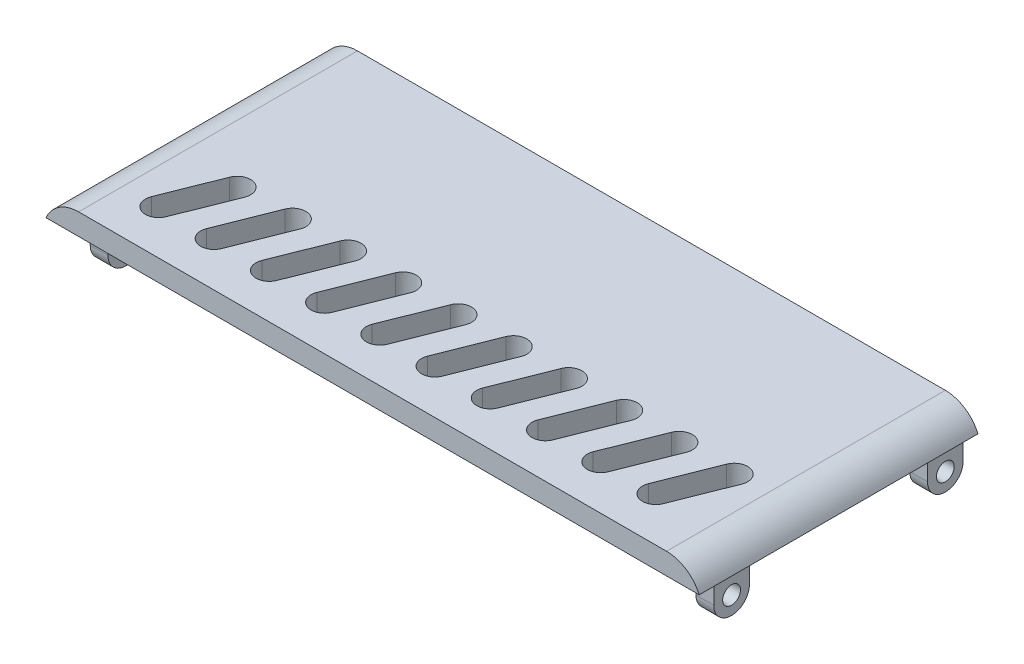
from build123d import *

# Parameters (mm, degrees)
SKETCH_2_W                     = 74
SKETCH_2_H                     = 31.3
EXTRUDE_1_DEPTH                = 4
FILLET_1_R                     = 4
SKETCH_3_W                     = 74
SKETCH_3_H                     = 1.6
CUT_EXTRUDE_1_DEPTH            = 54.265384914
CUT_EXTRUDE_6_REACH            = 49.036
SKETCH_22_W                    = 2
SKETCH_22_H                    = 4
EXTRUDE_9_DEPTH                = 5.5
FILLET_3_R                     = 2
SKETCH_23_R                    = 1
CUT_EXTRUDE_9_DEPTH            = 2
CUT_EXTRUDE_9_DRAFT            = -4
CUT_EXTRUDE_9_PROFILE_2_DEPTH  = 2
CUT_EXTRUDE_9_PROFILE_2_DRAFT  = -4
SKETCH_24_W                    = 4
SKETCH_24_H                    = 2
EXTRUDE_10_DEPTH               = 0.2
SKETCH_25_W                    = 0.670438174
SKETCH_25_H                    = 3.5
CUT_EXTRUDE_10_DEPTH           = 0.4
SKETCH_26_R                    = 1
CUT_EXTRUDE_11_DEPTH           = 2
CUT_EXTRUDE_11_DRAFT           = -4
CUT_EXTRUDE_11_PROFILE_2_DEPTH = 2
CUT_EXTRUDE_11_PROFILE_2_DRAFT = -4
SKETCH_27_W                    = 2.894334969
SKETCH_27_H                    = 0.686340867
SKETCH_27_W_2                  = 5.094334969
EXTRUDE_11_DEPTH               = 3
CHAMFER_1_SIZE                 = 1


# Some blends are built 0.0001 mm under size
with BuildPart() as part:
    # 草图2 → 凸台-拉伸1 (new body)
    with BuildSketch(Plane(origin=(0, 0, 0), x_dir=(1, 0, 0), z_dir=(0, 1, 0))):
        with Locations((5.91283293, 4.190435835)):
            Rectangle(SKETCH_2_W, SKETCH_2_H)
    extrude(amount=EXTRUDE_1_DEPTH)

    # 圆角1
    fillet_1_edges = [part.edges().sort_by_distance(p)[0] for p in [
        (-31.08716707, 4, -4.190435835),
        (42.91283293, 4, -4.190435835),
    ]]
    fillet(fillet_1_edges, radius=FILLET_1_R - 0.0001)  # a hair under: the kernel refuses the full size

    # 草图3 → 切除-拉伸1 (cut, through all)
    with BuildSketch(Plane(origin=(0, 0, -19.840435835), x_dir=(-1, 0, 0), z_dir=(0, 0, -1))):
        with Locations((-5.91283293, 0.8)):
            Rectangle(SKETCH_3_W, SKETCH_3_H)
    extrude(amount=-CUT_EXTRUDE_1_DEPTH, mode=Mode.SUBTRACT)

    # 草图19 → 切除-拉伸6 (cut, up to next)
    with BuildSketch(Plane(origin=(0, 4, 0), x_dir=(1, 0, 0), z_dir=(0, 1, 0)), mode=Mode.PRIVATE) as cut_extrude_6_sk1:
        with BuildLine():
            Line((-19.192931003, -0.712832445), (-21.692931003, -7.012832445))
            ThreePointArc((-21.692931003, -7.012832445), (-23.640435351, -7.853800231), (-24.481403137, -5.906295884))
            Line((-24.481403137, -5.906295884), (-21.981403137, 0.393704116))
            ThreePointArc((-21.981403137, 0.393704116), (-20.03389879, 1.234671902), (-19.192931003, -0.712832445))
        make_face()
    cut_extrude_6_tool1 = extrude(cut_extrude_6_sk1.sketch, amount=-CUT_EXTRUDE_6_REACH, mode=Mode.PRIVATE) & part.part
    # 草图19 → 切除-拉伸6 (cut, up to next)
    with BuildSketch(Plane(origin=(0, 4, 0), x_dir=(1, 0, 0), z_dir=(0, 1, 0)), mode=Mode.PRIVATE) as cut_extrude_6_sk2:
        with BuildLine():
            Line((-12.992931003, -0.712832445), (-15.492931003, -7.012832445))
            ThreePointArc((-15.492931003, -7.012832445), (-17.440435351, -7.853800231), (-18.281403137, -5.906295884))
            Line((-18.281403137, -5.906295884), (-15.781403137, 0.393704116))
            ThreePointArc((-15.781403137, 0.393704116), (-13.83389879, 1.234671902), (-12.992931003, -0.712832445))
        make_face()
    cut_extrude_6_tool2 = extrude(cut_extrude_6_sk2.sketch, amount=-CUT_EXTRUDE_6_REACH, mode=Mode.PRIVATE) & part.part
    # 草图19 → 切除-拉伸6 (cut, up to next)
    with BuildSketch(Plane(origin=(0, 4, 0), x_dir=(1, 0, 0), z_dir=(0, 1, 0)), mode=Mode.PRIVATE) as cut_extrude_6_sk3:
        with BuildLine():
            Line((-6.792931003, -0.712832445), (-9.292931003, -7.012832445))
            ThreePointArc((-9.292931003, -7.012832445), (-11.240435351, -7.853800231), (-12.081403137, -5.906295884))
            Line((-12.081403137, -5.906295884), (-9.581403137, 0.393704116))
            ThreePointArc((-9.581403137, 0.393704116), (-7.63389879, 1.234671902), (-6.792931003, -0.712832445))
        make_face()
    cut_extrude_6_tool3 = extrude(cut_extrude_6_sk3.sketch, amount=-CUT_EXTRUDE_6_REACH, mode=Mode.PRIVATE) & part.part
    # 草图19 → 切除-拉伸6 (cut, up to next)
    with BuildSketch(Plane(origin=(0, 4, 0), x_dir=(1, 0, 0), z_dir=(0, 1, 0)), mode=Mode.PRIVATE) as cut_extrude_6_sk4:
        with BuildLine():
            Line((-0.592931003, -0.712832445), (-3.092931003, -7.012832445))
            ThreePointArc((-3.092931003, -7.012832445), (-5.040435351, -7.853800231), (-5.881403137, -5.906295884))
            Line((-5.881403137, -5.906295884), (-3.381403137, 0.393704116))
            ThreePointArc((-3.381403137, 0.393704116), (-1.43389879, 1.234671902), (-0.592931003, -0.712832445))
        make_face()
    cut_extrude_6_tool4 = extrude(cut_extrude_6_sk4.sketch, amount=-CUT_EXTRUDE_6_REACH, mode=Mode.PRIVATE) & part.part
    # 草图19 → 切除-拉伸6 (cut, up to next)
    with BuildSketch(Plane(origin=(0, 4, 0), x_dir=(1, 0, 0), z_dir=(0, 1, 0)), mode=Mode.PRIVATE) as cut_extrude_6_sk5:
        with BuildLine():
            Line((5.607068997, -0.712832445), (3.107068997, -7.012832445))
            ThreePointArc((3.107068997, -7.012832445), (1.159564649, -7.853800231), (0.318596863, -5.906295884))
            Line((0.318596863, -5.906295884), (2.818596863, 0.393704116))
            ThreePointArc((2.818596863, 0.393704116), (4.76610121, 1.234671902), (5.607068997, -0.712832445))
        make_face()
    cut_extrude_6_tool5 = extrude(cut_extrude_6_sk5.sketch, amount=-CUT_EXTRUDE_6_REACH, mode=Mode.PRIVATE) & part.part
    # 草图19 → 切除-拉伸6 (cut, up to next)
    with BuildSketch(Plane(origin=(0, 4, 0), x_dir=(1, 0, 0), z_dir=(0, 1, 0)), mode=Mode.PRIVATE) as cut_extrude_6_sk6:
        with BuildLine():
            Line((11.807068997, -0.712832445), (9.307068997, -7.012832445))
            ThreePointArc((9.307068997, -7.012832445), (7.359564649, -7.853800231), (6.518596863, -5.906295884))
            Line((6.518596863, -5.906295884), (9.018596863, 0.393704116))
            ThreePointArc((9.018596863, 0.393704116), (10.96610121, 1.234671902), (11.807068997, -0.712832445))
        make_face()
    cut_extrude_6_tool6 = extrude(cut_extrude_6_sk6.sketch, amount=-CUT_EXTRUDE_6_REACH, mode=Mode.PRIVATE) & part.part
    # 草图19 → 切除-拉伸6 (cut, up to next)
    with BuildSketch(Plane(origin=(0, 4, 0), x_dir=(1, 0, 0), z_dir=(0, 1, 0)), mode=Mode.PRIVATE) as cut_extrude_6_sk7:
        with BuildLine():
            Line((18.007068997, -0.712832445), (15.507068997, -7.012832445))
            ThreePointArc((15.507068997, -7.012832445), (13.559564649, -7.853800231), (12.718596863, -5.906295884))
            Line((12.718596863, -5.906295884), (15.218596863, 0.393704116))
            ThreePointArc((15.218596863, 0.393704116), (17.16610121, 1.234671902), (18.007068997, -0.712832445))
        make_face()
    cut_extrude_6_tool7 = extrude(cut_extrude_6_sk7.sketch, amount=-CUT_EXTRUDE_6_REACH, mode=Mode.PRIVATE) & part.part
    # 草图19 → 切除-拉伸6 (cut, up to next)
    with BuildSketch(Plane(origin=(0, 4, 0), x_dir=(1, 0, 0), z_dir=(0, 1, 0)), mode=Mode.PRIVATE) as cut_extrude_6_sk8:
        with BuildLine():
            Line((24.207068997, -0.712832445), (21.707068997, -7.012832445))
            ThreePointArc((21.707068997, -7.012832445), (19.759564649, -7.853800231), (18.918596863, -5.906295884))
            Line((18.918596863, -5.906295884), (21.418596863, 0.393704116))
            ThreePointArc((21.418596863, 0.393704116), (23.36610121, 1.234671902), (24.207068997, -0.712832445))
        make_face()
    cut_extrude_6_tool8 = extrude(cut_extrude_6_sk8.sketch, amount=-CUT_EXTRUDE_6_REACH, mode=Mode.PRIVATE) & part.part
    # 草图19 → 切除-拉伸6 (cut, up to next)
    with BuildSketch(Plane(origin=(0, 4, 0), x_dir=(1, 0, 0), z_dir=(0, 1, 0)), mode=Mode.PRIVATE) as cut_extrude_6_sk9:
        with BuildLine():
            Line((30.407068997, -0.712832445), (27.907068997, -7.012832445))
            ThreePointArc((27.907068997, -7.012832445), (25.959564649, -7.853800231), (25.118596863, -5.906295884))
            Line((25.118596863, -5.906295884), (27.618596863, 0.393704116))
            ThreePointArc((27.618596863, 0.393704116), (29.56610121, 1.234671902), (30.407068997, -0.712832445))
        make_face()
    cut_extrude_6_tool9 = extrude(cut_extrude_6_sk9.sketch, amount=-CUT_EXTRUDE_6_REACH, mode=Mode.PRIVATE) & part.part
    # 草图19 → 切除-拉伸6 (cut, up to next)
    with BuildSketch(Plane(origin=(0, 4, 0), x_dir=(1, 0, 0), z_dir=(0, 1, 0)), mode=Mode.PRIVATE) as cut_extrude_6_sk10:
        with BuildLine():
            Line((36.607068997, -0.712832445), (34.107068997, -7.012832445))
            ThreePointArc((34.107068997, -7.012832445), (32.159564649, -7.853800231), (31.318596863, -5.906295884))
            Line((31.318596863, -5.906295884), (33.818596863, 0.393704116))
            ThreePointArc((33.818596863, 0.393704116), (35.76610121, 1.234671902), (36.607068997, -0.712832445))
        make_face()
    cut_extrude_6_tool10 = extrude(cut_extrude_6_sk10.sketch, amount=-CUT_EXTRUDE_6_REACH, mode=Mode.PRIVATE) & part.part
    add(cut_extrude_6_tool1.solids().sort_by_distance((-21.837167, 4, 3.309564))[0], mode=Mode.SUBTRACT)
    add(cut_extrude_6_tool2.solids().sort_by_distance((-15.637167, 4, 3.309564))[0], mode=Mode.SUBTRACT)
    add(cut_extrude_6_tool3.solids().sort_by_distance((-9.437167, 4, 3.309564))[0], mode=Mode.SUBTRACT)
    add(cut_extrude_6_tool4.solids().sort_by_distance((-3.237167, 4, 3.309564))[0], mode=Mode.SUBTRACT)
    add(cut_extrude_6_tool5.solids().sort_by_distance((2.962833, 4, 3.309564))[0], mode=Mode.SUBTRACT)
    add(cut_extrude_6_tool6.solids().sort_by_distance((9.162833, 4, 3.309564))[0], mode=Mode.SUBTRACT)
    add(cut_extrude_6_tool7.solids().sort_by_distance((15.362833, 4, 3.309564))[0], mode=Mode.SUBTRACT)
    add(cut_extrude_6_tool8.solids().sort_by_distance((21.562833, 4, 3.309564))[0], mode=Mode.SUBTRACT)
    add(cut_extrude_6_tool9.solids().sort_by_distance((27.762833, 4, 3.309564))[0], mode=Mode.SUBTRACT)
    add(cut_extrude_6_tool10.solids().sort_by_distance((33.962833, 4, 3.309564))[0], mode=Mode.SUBTRACT)

    # 草图22 → 凸台-拉伸9 (add)
    with BuildSketch(Plane.XZ.offset(-1.6)):
        with Locations((-28.08716707, 6.159564165)):
            Rectangle(SKETCH_22_W, SKETCH_22_H)
        with Locations((-28.08716707, -17.840435835)):
            Rectangle(SKETCH_22_W, SKETCH_22_H)
        with Locations((39.91283293, 6.159564165)):
            Rectangle(SKETCH_22_W, SKETCH_22_H)
        with Locations((39.91283293, -17.840435835)):
            Rectangle(SKETCH_22_W, SKETCH_22_H)
    extrude(amount=EXTRUDE_9_DEPTH)

    # 圆角3
    fillet_3_edges = [part.edges().sort_by_distance(p)[0] for p in [
        (-28.08716707, -3.9, -19.840435835),
        (-28.08716707, -3.9, -15.840435835),
        (-28.08716707, -3.9, 4.159564165),
        (-28.08716707, -3.9, 8.159564165),
        (39.91283293, -3.9, -19.840435835),
        (39.91283293, -3.9, -15.840435835),
        (39.91283293, -3.9, 4.159564165),
        (39.91283293, -3.9, 8.159564165),
    ]]
    fillet(fillet_3_edges, radius=FILLET_3_R - 0.0001)  # a hair under: the kernel refuses the full size


with BuildPart() as cut_extrude_9_tool:
    # 草图23 → 切除-拉伸9 (with draft: the straight prism first)
    with BuildSketch(Plane.ZY.offset(29.08716707)):
        with Locations((6.159564165, -1.9)):
            Circle(SKETCH_23_R)
    extrude(amount=-CUT_EXTRUDE_9_DEPTH)
    # 切除-拉伸9: the draft: its side faces are tilted about the plane it starts from
    cut_extrude_9_sides = [cut_extrude_9_tool.faces().sort_by_distance(p)[0] for p in [
        (-28.08716707, -1.9, 5.159564165),
    ]]
    draft(cut_extrude_9_sides, Plane.ZY.offset(29.08716707), CUT_EXTRUDE_9_DRAFT)


with BuildPart() as part_1:
    add(part.part)

    # 切除-拉伸9: cut by cut_extrude_9_tool
    add(cut_extrude_9_tool.part, mode=Mode.SUBTRACT)


with BuildPart() as cut_extrude_9_profile_2_tool:
    # 草图23 → 切除-拉伸9 profile 2 (with draft: the straight prism first)
    with BuildSketch(Plane.ZY.offset(29.08716707)):
        with Locations((-17.840435835, -1.9)):
            Circle(SKETCH_23_R)
    extrude(amount=-CUT_EXTRUDE_9_PROFILE_2_DEPTH)
    # 切除-拉伸9 profile 2: the draft: its side faces are tilted about the plane it starts from
    cut_extrude_9_profile_2_sides = [cut_extrude_9_profile_2_tool.faces().sort_by_distance(p)[0] for p in [
        (-28.08716707, -1.9, -18.840435835),
    ]]
    draft(cut_extrude_9_profile_2_sides, Plane.ZY.offset(29.08716707), CUT_EXTRUDE_9_PROFILE_2_DRAFT)


with BuildPart() as part_2:
    add(part_1.part)

    # 切除-拉伸9 profile 2: cut by cut_extrude_9_profile_2_tool
    add(cut_extrude_9_profile_2_tool.part, mode=Mode.SUBTRACT)

    # 草图24 → 凸台-拉伸10 (add)
    with BuildSketch(Plane.XZ.offset(-1.6)):
        with Locations((-16.753227626, 9.059564165)):
            Rectangle(SKETCH_24_W, SKETCH_24_H)
        with Locations((28.578893486, 9.059564165)):
            Rectangle(SKETCH_24_W, SKETCH_24_H)
    extrude(amount=EXTRUDE_10_DEPTH)

    # 草图25 → 切除-拉伸10 (cut)
    # profile 1 of 8: a face of its own
    with BuildSketch(Plane.XZ.offset(-1.6)):
        with BuildLine():
            add(Edge.make_bspline(
                [(-19.915555401, -12.030751926), (-19.93365258, -12.135844594), (-19.969454277, -12.34374969), (-20.020456164, -12.653830779), (-20.068842534, -12.961631846), (-20.097131232, -13.166939193), (-20.111321788, -13.269928219)],
                knots=[0, 0, 0, 0, 1.019964245, 2.017797891, 3.005661186, 4, 4, 4, 4], degree=3))
            Line((-20.111321788, -13.269928219), (-20.124360852, -13.269384334))
            add(Edge.make_bspline(
                [(-20.124360852, -13.269384334), (-20.136579183, -13.167863434), (-20.160867985, -12.966050192), (-20.207812968, -12.664887438), (-20.258455363, -12.363481718), (-20.296202723, -12.162372767), (-20.315224541, -12.061029052)],
                knots=[0, 0, 0, 0, 1.002730177, 1.993325802, 2.988787831, 4, 4, 4, 4], degree=3))
            Line((-20.315224541, -12.061029052), (-20.610060487, -10.5372501))
            Line((-20.610060487, -10.5372501), (-21.27279083, -10.5372501))
            Line((-21.27279083, -10.5372501), (-21.590538255, -12.042432566))
            add(Edge.make_bspline(
                [(-21.590538255, -12.042432566), (-21.614041318, -12.149701109), (-21.660314305, -12.360892127), (-21.719191187, -12.674577893), (-21.774092026, -12.978920483), (-21.803358206, -13.179656198), (-21.817770066, -13.278506652)],
                knots=[0, 0, 0, 0, 1.048193848, 2.063690999, 3.046482464, 4, 4, 4, 4], degree=3))
            Line((-21.817770066, -13.278506652), (-21.831118448, -13.278506652))
            add(Edge.make_bspline(
                [(-21.831118448, -13.278506652), (-21.844472399, -13.181690449), (-21.871900026, -12.982840037), (-21.918359916, -12.679396082), (-21.967472386, -12.367090399), (-22.004008831, -12.157103834), (-22.022332698, -12.051790739)],
                knots=[0, 0, 0, 0, 0.944566409, 1.940041169, 2.966883251, 4, 4, 4, 4], degree=3))
            Line((-22.022332698, -12.051790739), (-22.28958259, -10.5372501))
            Line((-22.28958259, -10.5372501), (-23.002254338, -10.5372501))
            Line((-23.002254338, -10.5372501), (-22.235111603, -14.033408751))
            Line((-22.235111603, -14.033408751), (-21.52698877, -14.033408751))
            Line((-21.52698877, -14.033408751), (-21.186545101, -12.557843532))
            add(Edge.make_bspline(
                [(-21.186545101, -12.557843532), (-21.166026176, -12.466452614), (-21.125122928, -12.284270295), (-21.070875862, -12.008352948), (-21.021763731, -11.727339161), (-20.992583507, -11.537359197), (-20.977743516, -11.440742361)],
                knots=[0, 0, 0, 0, 0.988746274, 1.971006476, 2.968128379, 4, 4, 4, 4], degree=3))
            Line((-20.977743516, -11.440742361), (-20.968661152, -11.44035958))
            add(Edge.make_bspline(
                [(-20.968661152, -11.44035958), (-20.957136928, -11.537541402), (-20.93451673, -11.728293677), (-20.89404252, -12.010124079), (-20.847291648, -12.285685858), (-20.810202693, -12.467171838), (-20.791657509, -12.557918284)],
                knots=[0, 0, 0, 0, 1.03744887, 2.036345133, 3.018135183, 4, 4, 4, 4], degree=3))
            Line((-20.791657509, -12.557918284), (-20.492040015, -14.033408751))
            Line((-20.492040015, -14.033408751), (-19.779377933, -14.033408751))
            Line((-19.779377933, -14.033408751), (-18.953234629, -10.5372501))
            Line((-18.953234629, -10.5372501), (-19.629582719, -10.5372501))
            Line((-19.629582719, -10.5372501), (-19.915555401, -12.030751926))
        make_face()
    # profile 2 of 8: a face of its own
    with BuildSketch(Plane.XZ.offset(-1.6)):
        Polygon((-16.667412187, -10.527870661), (-16.667412187, -11.92814647), (-17.855193922, -11.92814647), (-17.855193922, -10.527870661), (-18.525632096, -10.527870661), (-18.525632096, -14.021718445), (-17.855193922, -14.021718445), (-17.855193922, -12.511974821), (-16.667412187, -12.511974821), (-16.667412187, -14.021718445), (-15.996974013, -14.021718445), (-15.996974013, -10.527870661), align=None)
    # profile 3 of 8: a face of its own
    with BuildSketch(Plane.XZ.offset(-1.6)):
        with Locations((-14.980759326, -12.283408751)):
            Rectangle(SKETCH_25_W, SKETCH_25_H)
    # profile 4 of 8: a face of its own
    with BuildSketch(Plane.XZ.offset(-1.6)):
        with BuildLine():
            add(Edge.make_bspline(
                [(-14.094621443, -13.887075971), (-14.071524336, -13.8998562), (-14.022237313, -13.92712799), (-13.938166149, -13.959426351), (-13.842412309, -13.991603124), (-13.734627725, -14.018870559), (-13.618974189, -14.043391629), (-13.497538034, -14.061044296), (-13.372186916, -14.072510212), (-13.287093226, -14.074587823), (-13.243956271, -14.075641037)],
                knots=[0, 0, 0, 0, 0.719594672, 1.535546325, 2.452393094, 3.475924305, 4.567249392, 5.677640584, 6.822715122, 8, 8, 8, 8], degree=3))
            add(Edge.make_bspline(
                [(-13.243956271, -14.075641037), (-13.19485753, -14.07440688), (-13.099283654, -14.072004514), (-12.960699478, -14.056143351), (-12.830531079, -14.033879182), (-12.70955717, -14.001083345), (-12.596657, -13.961501375), (-12.493102635, -13.911549921), (-12.39813271, -13.853335065), (-12.312122238, -13.786826135), (-12.236476908, -13.712328977), (-12.168782833, -13.633490117), (-12.113595935, -13.547190674), (-12.066479286, -13.45655941), (-12.031306948, -13.359195282), (-12.004286129, -13.256645028), (-11.989535506, -13.147830958), (-11.986906464, -13.07354364), (-11.985566144, -13.035671011)],
                knots=[0, 0, 0, 0, 1.280827998, 2.493214574, 3.635842522, 4.723067123, 5.759595453, 6.75296466, 7.716578851, 8.661346905, 9.582605015, 10.482742654, 11.366187061, 12.249109382, 13.142470757, 14.061151216, 15.011549973, 16, 16, 16, 16], degree=3))
            add(Edge.make_bspline(
                [(-11.985566144, -13.035671011), (-11.986037397, -13.007279319), (-11.986967532, -12.951241204), (-11.995409405, -12.868616212), (-12.011136035, -12.789177257), (-12.030919445, -12.711957383), (-12.05924356, -12.638401979), (-12.092061591, -12.566994454), (-12.132075759, -12.499046748), (-12.177656458, -12.433272338), (-12.230309469, -12.37044222), (-12.289282408, -12.309444558), (-12.355270537, -12.250809323), (-12.428510159, -12.194862591), (-12.507549397, -12.139726235), (-12.594170688, -12.087894756), (-12.687578592, -12.038403066), (-12.752661826, -12.007547235), (-12.785999927, -11.991741709)],
                knots=[0, 0, 0, 0, 0.971604692, 1.917705205, 2.837533086, 3.741450306, 4.641944002, 5.53106885, 6.428441787, 7.336893241, 8.26704506, 9.230684205, 10.238479509, 11.285007773, 12.38342881, 13.535071349, 14.737370079, 16, 16, 16, 16], degree=3))
            add(Edge.make_bspline(
                [(-12.785999927, -11.991741709), (-12.811342513, -11.980185396), (-12.860494817, -11.957771763), (-12.930985254, -11.923614011), (-12.995858378, -11.889866755), (-13.055266849, -11.856863618), (-13.109716583, -11.824765219), (-13.158188384, -11.792246186), (-13.202021019, -11.761616655), (-13.240231263, -11.730841126), (-13.273839543, -11.699767341), (-13.302436853, -11.666590998), (-13.326467594, -11.63111661), (-13.346174678, -11.594022287), (-13.360982925, -11.554704846), (-13.371293167, -11.513751118), (-13.378500872, -11.470688981), (-13.378547812, -11.441212647), (-13.37857168, -11.426225013)],
                knots=[0, 0, 0, 0, 1.534293153, 2.975783242, 4.314400128, 5.561899513, 6.719353789, 7.794748337, 8.776507069, 9.664015056, 10.495494951, 11.294559956, 12.0708857, 12.851360931, 13.602992373, 14.37884518, 15.175702311, 16, 16, 16, 16], degree=3))
            add(Edge.make_bspline(
                [(-13.37857168, -11.426225013), (-13.377265795, -11.4011956), (-13.374679501, -11.351625036), (-13.350981737, -11.279850908), (-13.31175932, -11.213417384), (-13.266754709, -11.16397007), (-13.223599921, -11.128106352), (-13.185683763, -11.104622078), (-13.143893539, -11.08371727), (-13.097290846, -11.067868502), (-13.0470135, -11.05352843), (-12.992175971, -11.04392959), (-12.933040651, -11.038230772), (-12.892252244, -11.036482142), (-12.871124377, -11.035576374)],
                knots=[0, 0, 0, 0, 1.252807395, 2.481175558, 3.747276352, 5.098962457, 5.812468956, 6.556386487, 7.331171674, 8.151379655, 9.021437812, 9.952148669, 10.939239512, 12, 12, 12, 12], degree=3))
            add(Edge.make_bspline(
                [(-12.871124377, -11.035576374), (-12.836788174, -11.036713015), (-12.770398848, -11.038910719), (-12.674442049, -11.048658217), (-12.58577679, -11.064383852), (-12.504546454, -11.085534113), (-12.431274842, -11.110412356), (-12.36516994, -11.134298851), (-12.307146443, -11.159342313), (-12.272069922, -11.177899597), (-12.255456843, -11.18668877)],
                knots=[0, 0, 0, 0, 1.287765497, 2.48990501, 3.61253477, 4.660633034, 5.633348447, 6.512647364, 7.29555421, 8, 8, 8, 8], degree=3))
            Line((-12.255456843, -11.18668877), (-12.115386473, -10.645898222))
            add(Edge.make_bspline(
                [(-12.115386473, -10.645898222), (-12.137141815, -10.635943632), (-12.182519205, -10.615180305), (-12.255463018, -10.586092941), (-12.337383133, -10.562329211), (-12.426310776, -10.53767375), (-12.523551916, -10.51833199), (-12.628303199, -10.502731908), (-12.740793109, -10.494816086), (-12.818105062, -10.492848937), (-12.857926788, -10.491835701)],
                knots=[0, 0, 0, 0, 0.751083297, 1.566612858, 2.462144976, 3.426904781, 4.462872615, 5.572206229, 6.749495582, 8, 8, 8, 8], degree=3))
            add(Edge.make_bspline(
                [(-12.857926788, -10.491835701), (-12.903715543, -10.493438872), (-12.992872257, -10.496560455), (-13.122381043, -10.511017351), (-13.244003876, -10.53399353), (-13.357652687, -10.565677774), (-13.463914818, -10.605062594), (-13.562137999, -10.653403878), (-13.652534852, -10.710310498), (-13.734186636, -10.775855437), (-13.807610638, -10.847519454), (-13.871115457, -10.925271035), (-13.925895853, -11.00741212), (-13.970366471, -11.095136704), (-14.004598138, -11.188040625), (-14.029661736, -11.285750553), (-14.046043822, -11.388512234), (-14.048444662, -11.458936286), (-14.049669089, -11.494852477)],
                knots=[0, 0, 0, 0, 1.256955866, 2.447457956, 3.572082846, 4.649959342, 5.681406033, 6.67750641, 7.648772353, 8.6065338, 9.545567091, 10.459092244, 11.356420819, 12.24994494, 13.151405518, 14.067877277, 15.01461949, 16, 16, 16, 16], degree=3))
            add(Edge.make_bspline(
                [(-14.049669089, -11.494852477), (-14.048618599, -11.523045909), (-14.046542462, -11.578766078), (-14.034942422, -11.660866475), (-14.017453901, -11.740279365), (-13.992189333, -11.816764638), (-13.959402454, -11.889939453), (-13.921412438, -11.961081046), (-13.875342389, -12.028720277), (-13.822331599, -12.093194845), (-13.763704529, -12.154960902), (-13.699715586, -12.214162624), (-13.63054045, -12.270829353), (-13.555549662, -12.324778278), (-13.475910773, -12.377417055), (-13.389724377, -12.425466953), (-13.299289633, -12.473109148), (-13.235990007, -12.501304683), (-13.203703624, -12.515685998)],
                knots=[0, 0, 0, 0, 0.960729928, 1.898741275, 2.820565259, 3.728266954, 4.637606962, 5.549753057, 6.472673147, 7.420779733, 8.390934511, 9.372027768, 10.389211705, 11.435574366, 12.518575566, 13.639649148, 14.796087777, 16, 16, 16, 16], degree=3))
            add(Edge.make_bspline(
                [(-13.203703624, -12.515685998), (-13.158951279, -12.535933578), (-13.074708621, -12.574048003), (-12.960364112, -12.63771492), (-12.864438062, -12.70154931), (-12.787388086, -12.768447611), (-12.726455761, -12.838751642), (-12.685319686, -12.916905421), (-12.65918763, -13.001451413), (-12.657081002, -13.060330334), (-12.656003674, -13.090441006)],
                knots=[0, 0, 0, 0, 1.393665495, 2.6234622, 3.710952145, 4.657720235, 5.513058752, 6.334242817, 7.148131986, 8, 8, 8, 8], degree=3))
            add(Edge.make_bspline(
                [(-12.656003674, -13.090441006), (-12.656313921, -13.10674227), (-12.656920383, -13.138607417), (-12.663707114, -13.185065119), (-12.674777801, -13.228961213), (-12.691030872, -13.270128413), (-12.710611569, -13.309357472), (-12.735303659, -13.345876404), (-12.764570762, -13.379723686), (-12.798246386, -13.410682131), (-12.836117531, -13.438494302), (-12.878094469, -13.463103975), (-12.924284359, -13.484142047), (-12.974696076, -13.501299054), (-13.029313881, -13.514299831), (-13.087929069, -13.524244912), (-13.151022567, -13.53003551), (-13.194453993, -13.531264941), (-13.216901213, -13.531900363)],
                knots=[0, 0, 0, 0, 0.969766496, 1.895666023, 2.788091005, 3.658633537, 4.525326931, 5.393305268, 6.275294433, 7.18343149, 8.110533905, 9.067217099, 10.075045017, 11.126827756, 12.232027601, 13.413846859, 14.663365337, 16, 16, 16, 16], degree=3))
            add(Edge.make_bspline(
                [(-13.216901213, -13.531900363), (-13.2521164, -13.530762226), (-13.322032274, -13.528502581), (-13.42594556, -13.518047925), (-13.527746108, -13.500039565), (-13.626666825, -13.475809247), (-13.720811043, -13.446201793), (-13.808929324, -13.413455147), (-13.889761395, -13.376766622), (-13.939660322, -13.348378156), (-13.963884759, -13.334596406)],
                knots=[0, 0, 0, 0, 1.082450425, 2.149086012, 3.20582521, 4.256603573, 5.276294291, 6.236645749, 7.143944243, 8, 8, 8, 8], degree=3))
            Line((-13.963884759, -13.334596406), (-14.094621443, -13.887075971))
        make_face()
    # profile 5 of 8: a face of its own
    with BuildSketch(Plane.XZ.offset(-1.6)):
        with BuildLine():
            Line((-10.802402276, -14.057850712), (-10.802402276, -12.744004935))
            add(Edge.make_bspline(
                [(-10.802402276, -12.744004935), (-10.784853604, -12.747445847), (-10.747996709, -12.754672682), (-10.689579764, -12.75847505), (-10.626295646, -12.763470488), (-10.582456356, -12.763253888), (-10.559566636, -12.763140795)],
                knots=[0, 0, 0, 0, 0.878556077, 1.845202224, 2.874919808, 4, 4, 4, 4], degree=3))
            add(Edge.make_bspline(
                [(-10.559566636, -12.763140795), (-10.524362564, -12.763680827), (-10.453636135, -12.764765775), (-10.347252681, -12.756547095), (-10.240484029, -12.739974504), (-10.133602665, -12.714672427), (-10.026493343, -12.681530814), (-9.919054041, -12.640497718), (-9.811775121, -12.590556083), (-9.704534254, -12.534490793), (-9.601818344, -12.467222392), (-9.512412114, -12.381736966), (-9.434055476, -12.283376052), (-9.370181594, -12.169359658), (-9.31774395, -12.04155937), (-9.278949676, -11.899003114), (-9.251568821, -11.742346687), (-9.244262795, -11.632880859), (-9.2404676, -11.57601765)],
                knots=[0, 0, 0, 0, 0.841321464, 1.69024945, 2.54697463, 3.421933785, 4.313421963, 5.225513963, 6.16898692, 7.140527675, 8.117658811, 9.092268315, 10.084297122, 11.113479625, 12.205185911, 13.378908979, 14.638445907, 16, 16, 16, 16], degree=3))
            add(Edge.make_bspline(
                [(-9.2404676, -11.57601765), (-9.241603469, -11.535919141), (-9.243835997, -11.457106382), (-9.261524708, -11.34216375), (-9.289066438, -11.23277627), (-9.328051278, -11.129939863), (-9.376837674, -11.03416408), (-9.434399962, -10.946614209), (-9.500606431, -10.867335367), (-9.551962162, -10.822459859), (-9.577666003, -10.799999408)],
                knots=[0, 0, 0, 0, 1.10039744, 2.162807532, 3.18512533, 4.192295778, 5.175353367, 6.130031606, 7.064069995, 8, 8, 8, 8], degree=3))
            add(Edge.make_bspline(
                [(-9.577666003, -10.799999408), (-9.60689649, -10.778184528), (-9.666222919, -10.733908875), (-9.765968923, -10.679268064), (-9.875259788, -10.633138034), (-9.994636914, -10.595759946), (-10.123925382, -10.566561326), (-10.263263226, -10.547712226), (-10.412404785, -10.53527699), (-10.515107081, -10.534479717), (-10.568145069, -10.534067986)],
                knots=[0, 0, 0, 0, 0.836606025, 1.697982253, 2.603178176, 3.556730869, 4.566307281, 5.642647, 6.782605007, 8, 8, 8, 8], degree=3))
            add(Edge.make_bspline(
                [(-10.568145069, -10.534067986), (-10.615001665, -10.534493295), (-10.70587764, -10.535318159), (-10.83850834, -10.540388467), (-10.963233044, -10.546238067), (-11.080562161, -10.55301837), (-11.189634262, -10.563209158), (-11.291314021, -10.574296898), (-11.385146907, -10.587028246), (-11.44494094, -10.598077838), (-11.473499685, -10.603355329)],
                knots=[0, 0, 0, 0, 1.236942669, 2.398987101, 3.50349081, 4.533253662, 5.501087568, 6.394974819, 7.233410034, 8, 8, 8, 8], degree=3))
            Line((-11.473499685, -10.603355329), (-11.47284045, -14.057850712))
            Line((-11.47284045, -14.057850712), (-10.802402276, -14.057850712))
        make_face()
        with BuildLine():
            add(Edge.make_bspline(
                [(-10.802402276, -11.062395577), (-10.785734689, -11.058662986), (-10.747645496, -11.050133176), (-10.682408919, -11.043490021), (-10.603018867, -11.037048811), (-10.545289096, -11.036093544), (-10.514034953, -11.035576374)],
                knots=[0, 0, 0, 0, 0.70585537, 1.613038518, 2.7077303, 4, 4, 4, 4], degree=3))
            add(Edge.make_bspline(
                [(-10.514034953, -11.035576374), (-10.491354173, -11.03581282), (-10.446967312, -11.036275551), (-10.382406806, -11.044075293), (-10.32140273, -11.05488069), (-10.264374293, -11.070738097), (-10.211106722, -11.091304437), (-10.161675926, -11.116421229), (-10.115369904, -11.145615109), (-10.073439519, -11.179876164), (-10.035332386, -11.218390454), (-10.002341728, -11.261401338), (-9.974225539, -11.308727095), (-9.952056364, -11.360582261), (-9.934119945, -11.416466434), (-9.920979845, -11.476540492), (-9.913114478, -11.541061788), (-9.911656936, -11.58545402), (-9.910905129, -11.608351744)],
                knots=[0, 0, 0, 0, 1.150647283, 2.251845908, 3.296564491, 4.293585939, 5.251638342, 6.190496202, 7.10431693, 8.025138136, 8.933209785, 9.848938853, 10.770098533, 11.720244083, 12.705502524, 13.745915437, 14.837332513, 16, 16, 16, 16], degree=3))
            add(Edge.make_bspline(
                [(-9.910905129, -11.608351744), (-9.911695142, -11.631682931), (-9.913242354, -11.677376271), (-9.920723278, -11.743985899), (-9.934970347, -11.806625718), (-9.953672743, -11.865408637), (-9.978714085, -11.919911591), (-10.0074311, -11.971334547), (-10.042828699, -12.018244019), (-10.083059528, -12.061211331), (-10.128259998, -12.099651336), (-10.177895288, -12.133541059), (-10.232252192, -12.161838868), (-10.291112269, -12.185103342), (-10.354089969, -12.203340705), (-10.42163226, -12.216682105), (-10.493403756, -12.224388067), (-10.542831793, -12.225889749), (-10.568145069, -12.226658796)],
                knots=[0, 0, 0, 0, 1.095951735, 2.146384348, 3.141117811, 4.107846426, 5.036936284, 5.952845255, 6.867880406, 7.788493674, 8.711536769, 9.648229827, 10.604475232, 11.582556545, 12.615324965, 13.678675286, 14.811194273, 16, 16, 16, 16], degree=3))
            add(Edge.make_bspline(
                [(-10.568145069, -12.226658796), (-10.591029369, -12.226682047), (-10.634625838, -12.226726344), (-10.696656926, -12.223013683), (-10.752147373, -12.21874662), (-10.786387268, -12.211998394), (-10.802402276, -12.20884205)],
                knots=[0, 0, 0, 0, 1.166410307, 2.222107342, 3.16842715, 4, 4, 4, 4], degree=3))
            Line((-10.802402276, -12.20884205), (-10.802402276, -11.062395577))
        make_face(mode=Mode.SUBTRACT)
    # profile 6 of 8: a face of its own
    with BuildSketch(Plane.XZ.offset(-1.6)):
        Polygon((-8.057303732, -13.448508097), (-8.057303732, -10.511121709), (-8.727741905, -10.511121709), (-8.727741905, -14.032336447), (-6.80298501, -14.032336447), (-6.80298501, -13.448508097), align=None)
    # profile 7 of 8: a face of its own
    with BuildSketch(Plane.XZ.offset(-1.6)):
        Polygon((-5.621331648, -10.533408751), (-6.615664307, -14.030214393), (-5.931490459, -14.030214393), (-5.689749033, -13.104299119), (-4.750150281, -13.104299119), (-4.499286537, -14.030214393), (-3.792306894, -14.030214393), (-4.772956076, -10.533408751), align=None)
        with BuildLine():
            add(Edge.make_bspline(
                [(-5.384151381, -11.794015016), (-5.370992737, -11.738105602), (-5.343393012, -11.620837859), (-5.304645563, -11.440412696), (-5.265928856, -11.257669951), (-5.241502969, -11.136337688), (-5.229720255, -11.07780866)],
                knots=[0, 0, 0, 0, 0.94066455, 1.973005993, 3.022205752, 4, 4, 4, 4], degree=3))
            Line((-5.229720255, -11.07780866), (-5.215388498, -11.077150069))
            add(Edge.make_bspline(
                [(-5.215388498, -11.077150069), (-5.20321691, -11.134776606), (-5.177895349, -11.254661861), (-5.13963045, -11.436992422), (-5.099092133, -11.620100778), (-5.070195354, -11.740586207), (-5.056171958, -11.799056907)],
                knots=[0, 0, 0, 0, 0.95601635, 1.988879968, 3.024018124, 4, 4, 4, 4], degree=3))
            Line((-5.056171958, -11.799056907), (-4.84593462, -12.602790087))
            Line((-4.84593462, -12.602790087), (-5.593964694, -12.602790087))
            Line((-5.593964694, -12.602790087), (-5.384151381, -11.794015016))
        make_face(mode=Mode.SUBTRACT)
    # profile 8 of 8: a face of its own
    with BuildSketch(Plane.XZ.offset(-1.6)):
        with BuildLine():
            add(Edge.make_bspline(
                [(-2.016626693, -11.388991444), (-2.041132315, -11.450571422), (-2.089388548, -11.571834112), (-2.156141239, -11.752697579), (-2.216084491, -11.929567938), (-2.252776262, -12.046443457), (-2.270820766, -12.103921217)],
                knots=[0, 0, 0, 0, 1.04780428, 2.063325938, 3.047570549, 4, 4, 4, 4], degree=3))
            Line((-2.270820766, -12.103921217), (-2.279379867, -12.103575811))
            add(Edge.make_bspline(
                [(-2.279379867, -12.103575811), (-2.299648186, -12.044453331), (-2.339954798, -11.926879355), (-2.404025257, -11.751321919), (-2.471367215, -11.573809597), (-2.518561294, -11.454759774), (-2.542691103, -11.39389092)],
                knots=[0, 0, 0, 0, 0.99066983, 1.970096485, 2.96213286, 4, 4, 4, 4], degree=3))
            Line((-2.542691103, -11.39389092), (-2.888034248, -10.533408751))
            Line((-2.888034248, -10.533408751), (-3.640625481, -10.533408751))
            Line((-3.640625481, -10.533408751), (-2.646292822, -12.60879151))
            Line((-2.646292822, -12.60879151), (-2.646292822, -14.033408751))
            Line((-2.646292822, -14.033408751), (-1.975854648, -14.033408751))
            Line((-1.975854648, -14.033408751), (-1.975854648, -12.586034046))
            Line((-1.975854648, -12.586034046), (-0.935910399, -10.533408751))
            Line((-0.935910399, -10.533408751), (-1.679379314, -10.533408751))
            Line((-1.679379314, -10.533408751), (-2.016626693, -11.388991444))
        make_face()
    extrude(amount=-CUT_EXTRUDE_10_DEPTH, mode=Mode.SUBTRACT)


with BuildPart() as cut_extrude_11_tool:
    # 草图26 → 切除-拉伸11 (with draft: the straight prism first)
    with BuildSketch(Plane(origin=(40.91283293, 0, 0), x_dir=(0, 0, -1), z_dir=(1, 0, 0))):
        with Locations((17.840435835, -1.9)):
            Circle(SKETCH_26_R)
    extrude(amount=-CUT_EXTRUDE_11_DEPTH)
    # 切除-拉伸11: the draft: its side faces are tilted about the plane it starts from
    cut_extrude_11_sides = [cut_extrude_11_tool.faces().sort_by_distance(p)[0] for p in [
        (39.91283293, -1.9, -16.840435835),
    ]]
    draft(cut_extrude_11_sides, Plane(origin=(40.91283293, 0, 0), x_dir=(0, 0, -1), z_dir=(1, 0, 0)), CUT_EXTRUDE_11_DRAFT)


with BuildPart() as part_3:
    add(part_2.part)

    # 切除-拉伸11: cut by cut_extrude_11_tool
    add(cut_extrude_11_tool.part, mode=Mode.SUBTRACT)


with BuildPart() as cut_extrude_11_profile_2_tool:
    # 草图26 → 切除-拉伸11 profile 2 (with draft: the straight prism first)
    with BuildSketch(Plane(origin=(40.91283293, 0, 0), x_dir=(0, 0, -1), z_dir=(1, 0, 0))):
        with Locations((-6.159564165, -1.9)):
            Circle(SKETCH_26_R)
    extrude(amount=-CUT_EXTRUDE_11_PROFILE_2_DEPTH)
    # 切除-拉伸11 profile 2: the draft: its side faces are tilted about the plane it starts from
    cut_extrude_11_profile_2_sides = [cut_extrude_11_profile_2_tool.faces().sort_by_distance(p)[0] for p in [
        (39.91283293, -1.9, 7.159564165),
    ]]
    draft(cut_extrude_11_profile_2_sides, Plane(origin=(40.91283293, 0, 0), x_dir=(0, 0, -1), z_dir=(1, 0, 0)), CUT_EXTRUDE_11_PROFILE_2_DRAFT)


with BuildPart() as part_4:
    add(part_3.part)

    # 切除-拉伸11 profile 2: cut by cut_extrude_11_profile_2_tool
    add(cut_extrude_11_profile_2_tool.part, mode=Mode.SUBTRACT)

    # 草图27 → 凸台-拉伸11 (add)
    with BuildSketch(Plane.XZ.offset(-1.6)):
        with Locations((-25.639999586, 7.816393732)):
            Rectangle(SKETCH_27_W, SKETCH_27_H)
        with Locations((36.365665445, 7.816393732)):
            Rectangle(SKETCH_27_W_2, SKETCH_27_H)
    extrude(amount=EXTRUDE_11_DEPTH)

    # 倒角1
    # the kernel refuses this chamfer: 1 mm, written as the material it takes off along each edge
    with BuildSketch(Plane(origin=(-21.621149113, -1.4, 8.159564165), x_dir=(0, -0.02749587661058627, -0.9996219169112968), z_dir=(-1, 0, 0))) as chamfer_1_piece_1:
        Polygon((CHAMFER_1_SIZE * 0.999621916911, -CHAMFER_1_SIZE * 0.0274958766106), (-CHAMFER_1_SIZE * 0.0274958766106, -CHAMFER_1_SIZE * 0.999621916911), (0, 0), align=None)
    extrude(amount=5.466017957, mode=Mode.SUBTRACT)
    with BuildSketch(Plane(origin=(31.246814973, -1.4, 8.159564165), x_dir=(0, -0.02749587661058627, -0.9996219169112968), z_dir=(1, 0, 0))) as chamfer_1_piece_2:
        Polygon((CHAMFER_1_SIZE * 0.999621916911, CHAMFER_1_SIZE * 0.0274958766106), (-CHAMFER_1_SIZE * 0.0274958766106, CHAMFER_1_SIZE * 0.999621916911), (0, 0), align=None)
    extrude(amount=7.666017957, mode=Mode.SUBTRACT)


solid = part_4.part
